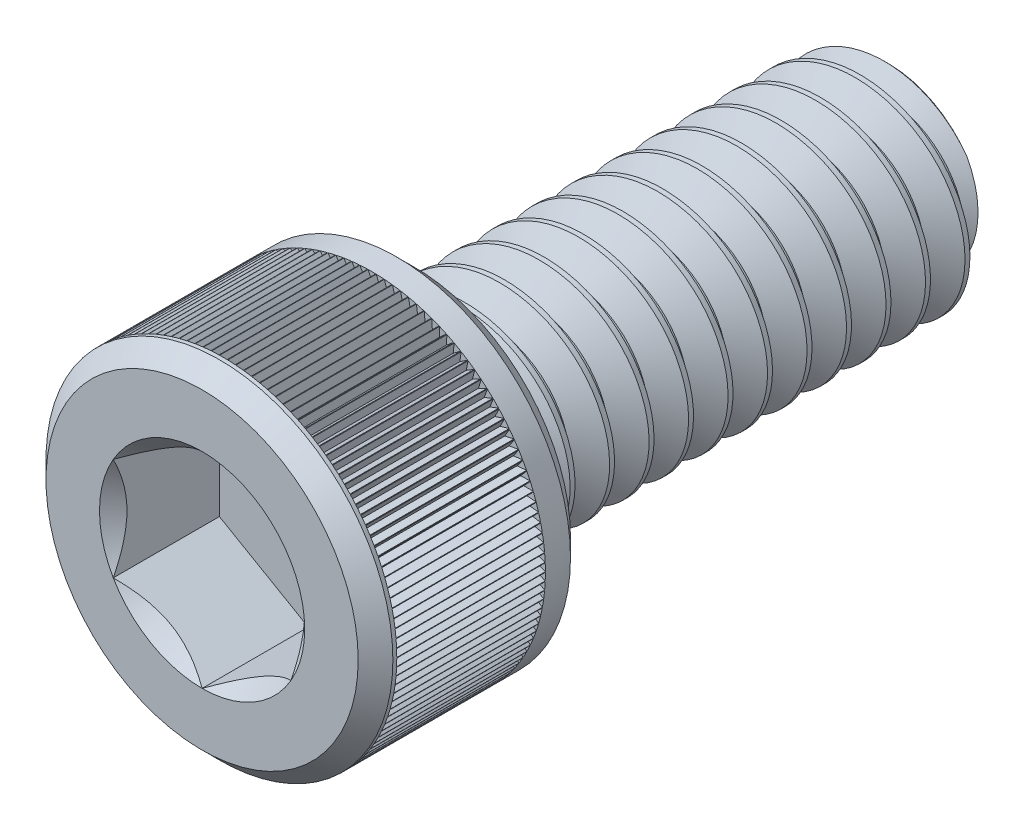
from build123d import *

# Parameters (mm, degrees)
CUT_EXTRUDE1_DEPTH = 1.4224
CUT_SWEEP1_PITCH   = 0.529166667
CUT_EXTRUDE3_START = 1.13792
CUT_EXTRUDE3_DEPTH = 1.99136
CIRPATTERN1_COUNT  = 134


# Read off the part's stored shape, not the designer's step: Split1
with BuildPart() as part:
    # Sketch2 → Revolve1 (revolve)
    with BuildSketch(Plane(origin=(0, 0, 0), x_dir=(0, 0, -1), z_dir=(1, 0, 0)), mode=Mode.PRIVATE) as revolve1_sk:
        Polygon((6.35, 1.28016), (6.20776, 1.4224), (0, 1.4224), (0, 2.09169), (-0.23241, 2.3241), (-2.61239, 2.3241), (-2.8448, 2.09169), (-2.8448, 1.190625), (-1.4224, 1.190625), (-1.4224, 0), (6.35, 0), align=None)
    revolve(revolve1_sk.sketch.rotate(Axis((0, 0, 1.4224), (0, 0, -1)), 90), axis=Axis((0, 0, 1.4224), (0, 0, -1)))

    # Sketch3 → Cut-Extrude1 (cut)
    with BuildSketch(Plane.XY.offset(2.8448)):
        Polygon((0, 1.374815329), (-1.190625, 0.687407664), (-1.190625, -0.687407664), (0, -1.374815329), (1.190625, -0.687407664), (1.190625, 0.687407664), align=None)
    extrude(amount=-CUT_EXTRUDE1_DEPTH, mode=Mode.SUBTRACT)

    # Cut-Extrude2 cone 1 section (through the dimple's axis) → Cut-Extrude2 (revolve, cut)
    with BuildSketch(Plane(origin=(0, 0, 2.8448), x_dir=(0, -1, 0), z_dir=(1, 0, 0))):
        Polygon((0, 0), (1.374815329, 0), (0, 1.374815329), align=None)
    revolve(axis=Axis((0, 0, 2.8448), (0, 0, -1)), mode=Mode.SUBTRACT)


with BuildPart() as body_2:
    # Split1: the piece on the far side of the plane
    add(part.part)
    split(bisect_by=Plane.XY, keep=Keep.BOTTOM)

    # Cut-Sweep1: the profile of Sketch7 screwed along a right-hand helix of 13 turns, 6 arcs to a turn; built about Z, then put on its axis
    cut_sweep1_z = Axis((0, 0, 0), (0, 0, 1))
    cut_sweep1_corners = [(1.451041986, 0, -0.479557292), (1.479683972, 0, 0.033072917), (1.078696168, 0, -0.1984375), (1.078696168, 0, -0.264583333)]
    with BuildLine(mode=Mode.PRIVATE) as cut_sweep1_profile:
        Line(cut_sweep1_corners[0], cut_sweep1_corners[1])
        Line(cut_sweep1_corners[1], cut_sweep1_corners[2])
        Line(cut_sweep1_corners[2], cut_sweep1_corners[3])
        Line(cut_sweep1_corners[3], cut_sweep1_corners[0])
    cut_sweep1_cap = Face(cut_sweep1_profile.wire())
    cut_sweep1_turn_angles = [0, 30, 60, 90, 120, 150, 180, 210, 240, 270, 300, 330, 360]
    cut_sweep1_turn_weights = [1, 0.8660254037844387, 1, 0.8660254037844387, 1, 0.8660254037844387, 1, 0.8660254037844387, 1, 0.8660254037844387, 1, 0.8660254037844387, 1]
    cut_sweep1_turn_rails = [Edge.make_bspline([Vector(p[0], p[1], 0).rotate(cut_sweep1_z, cut_sweep1_turn_angles[k]) / cut_sweep1_turn_weights[k] + Vector(0, 0, p[2] + CUT_SWEEP1_PITCH * cut_sweep1_turn_angles[k] / 360) for k in range(13)], [0, 0, 0, 1, 1, 2, 2, 3, 3, 4, 4, 5, 5, 6, 6, 6], 2, cut_sweep1_turn_weights) for p in cut_sweep1_corners]
    cut_sweep1_turn_sides = [Face.make_surface_from_curves(cut_sweep1_turn_rails[p[0]], cut_sweep1_turn_rails[p[1]]) for p in [(0, 1), (1, 2), (2, 3), (3, 0)]]
    cut_sweep1 = Plane(origin=(0, 0, 0), x_dir=(0, 1, 0), z_dir=(0, 0, -1)) * Solid(Shell([*[p.moved(Location((0, 0, CUT_SWEEP1_PITCH * i))) for i in range(13) for p in cut_sweep1_turn_sides], cut_sweep1_cap, cut_sweep1_cap.rotate(cut_sweep1_z, 4680).moved(Location((0, 0, CUT_SWEEP1_PITCH * 4680 / 360)))]))
    add(cut_sweep1, mode=Mode.SUBTRACT)


with BuildPart() as part_1:
    add(part.part)

    # Split1
    split(bisect_by=Plane.XY, keep=Keep.TOP)

    # Combine1: union body 2
    add(body_2.part)

    # Sketch8 → Cut-Extrude3 (cut)
    with BuildSketch(Plane.XY.offset(1.4224).offset(CUT_EXTRUDE3_START)):
        with BuildLine():
            Line((-0.050699974, 2.323546927), (0, 2.207895))
            Line((0, 2.207895), (0.050699974, 2.323546927))
            ThreePointArc((0.050699974, 2.323546927), (0, 2.3241), (-0.050699974, 2.323546927))
        make_face()
    cut_extrude3 = extrude(amount=-CUT_EXTRUDE3_DEPTH, mode=Mode.SUBTRACT)

    # CirPattern1: Cut-Extrude3 ×134 about axis
    cirpattern1_axis = Axis((0, 0, 0), (0, 0, 1))
    for i in range(1, CIRPATTERN1_COUNT):
        add(cut_extrude3.rotate(cirpattern1_axis, i * 360 / CIRPATTERN1_COUNT), mode=Mode.SUBTRACT)


solid = part_1.part
